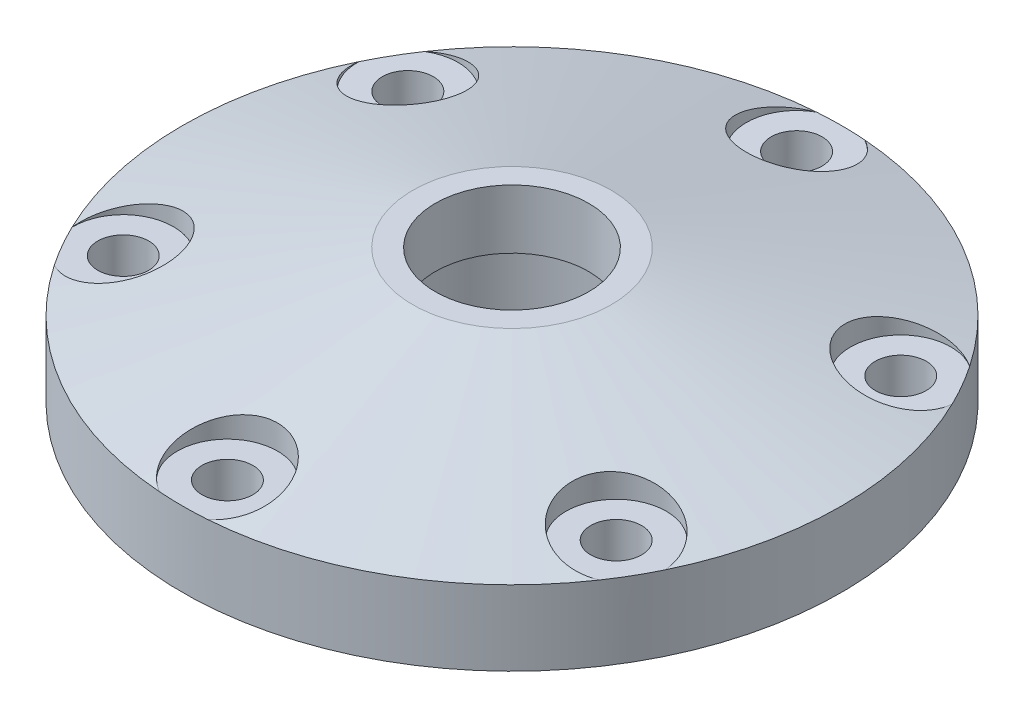
from build123d import *

# Parameters (mm, degrees)
M3_CLEARANCE_HOLE1_AT_2_COUNT  = 2
M3_CLEARANCE_HOLE1_AT_2_PITCH  = 19
M3_CLEARANCE_HOLE1_AT_3_COUNT  = 2
M3_CLEARANCE_HOLE1_AT_3_PITCH  = 32.908965344
M3_CLEARANCE_HOLE1_AT_4_COUNT  = 2
M3_CLEARANCE_HOLE1_AT_4_PITCH  = 38
M3_CLEARANCE_HOLE1_AT_5_COUNT  = 2
M3_CLEARANCE_HOLE1_AT_5_PITCH  = 32.908965344
M3_CLEARANCE_HOLE1_AT_6_COUNT  = 2
M3_CLEARANCE_HOLE1_AT_6_PITCH  = 19
M3_CLEARANCE_HOLE1_AT_7_COUNT  = 2
M3_CLEARANCE_HOLE1_AT_7_PITCH  = 19
CBORE_FOR_M3_SBHCS7_AT_2_COUNT = 2
CBORE_FOR_M3_SBHCS7_AT_2_PITCH = 19
CBORE_FOR_M3_SBHCS7_AT_3_COUNT = 2
CBORE_FOR_M3_SBHCS7_AT_3_PITCH = 32.908965344
CBORE_FOR_M3_SBHCS7_AT_4_COUNT = 2
CBORE_FOR_M3_SBHCS7_AT_4_PITCH = 38
CBORE_FOR_M3_SBHCS7_AT_5_COUNT = 2
CBORE_FOR_M3_SBHCS7_AT_5_PITCH = 32.908965344
CBORE_FOR_M3_SBHCS7_AT_6_COUNT = 2
CBORE_FOR_M3_SBHCS7_AT_6_PITCH = 19


with BuildPart() as part:
    # Sketch1 → Revolve1 (revolve)
    with BuildSketch(Plane.XY):
        Polygon((5.12, 5), (5.12, 8.9453), (6.625, 8.9453), (22, 5), (22, 0), (6.75, 0), (6.75, 5), align=None)
    revolve(axis=Axis((0, 0, 0), (0, 1, 0)))

    # Sketch3 → M3 Clearance Hole1 (revolve, cut)
    with BuildSketch(Plane(origin=(0, 5, -19), x_dir=(0, 0, 1), z_dir=(1, 0, 0))):
        Polygon((0, 0), (0, 6.021463052), (1.7, 5), (1.7, 0), align=None)
    m3_clearance_hole1 = revolve(axis=Axis((0, 11.35, -19), (0, -1, 0)), mode=Mode.SUBTRACT)

    # M3 Clearance Hole1 at 2: M3 Clearance Hole1 ×2
    with Locations(*[Vector(0.8660254037844387, 0, 0.49999999999999994) * (i * M3_CLEARANCE_HOLE1_AT_2_PITCH) for i in range(1, M3_CLEARANCE_HOLE1_AT_2_COUNT)]):
        add(m3_clearance_hole1, mode=Mode.SUBTRACT)

    # M3 Clearance Hole1 at 3: M3 Clearance Hole1 ×2
    with Locations(*[Vector(0.5000000000000001, 0, 0.8660254037844386) * (i * M3_CLEARANCE_HOLE1_AT_3_PITCH) for i in range(1, M3_CLEARANCE_HOLE1_AT_3_COUNT)]):
        add(m3_clearance_hole1, mode=Mode.SUBTRACT)

    # M3 Clearance Hole1 at 4: M3 Clearance Hole1 ×2
    with Locations(*[(0, 0, i * M3_CLEARANCE_HOLE1_AT_4_PITCH) for i in range(1, M3_CLEARANCE_HOLE1_AT_4_COUNT)]):
        add(m3_clearance_hole1, mode=Mode.SUBTRACT)

    # M3 Clearance Hole1 at 5: M3 Clearance Hole1 ×2
    with Locations(*[Vector(-0.49999999999999983, 0, 0.8660254037844388) * (i * M3_CLEARANCE_HOLE1_AT_5_PITCH) for i in range(1, M3_CLEARANCE_HOLE1_AT_5_COUNT)]):
        add(m3_clearance_hole1, mode=Mode.SUBTRACT)

    # M3 Clearance Hole1 at 6: M3 Clearance Hole1 ×2
    with Locations(*[Vector(-0.8660254037844387, 0, 0.4999999999999999) * (i * M3_CLEARANCE_HOLE1_AT_6_PITCH) for i in range(1, M3_CLEARANCE_HOLE1_AT_6_COUNT)]):
        add(m3_clearance_hole1, mode=Mode.SUBTRACT)

    # M3 Clearance Hole1 at 7: M3 Clearance Hole1 ×2
    with Locations(*[(0, 0, i * M3_CLEARANCE_HOLE1_AT_7_PITCH) for i in range(1, M3_CLEARANCE_HOLE1_AT_7_COUNT)]):
        add(m3_clearance_hole1, mode=Mode.SUBTRACT)

    # Sketch5 → CBORE for M3 SBHCS7 (revolve, cut)
    with BuildSketch(Plane(origin=(-16.454482672, 5, -9.5), x_dir=(0, 0, -1), z_dir=(1, 0, 0))):
        Polygon((0, 0), (0, 4.966763052), (1.7, 3.9453), (1.7, 1.65), (3.35, 1.65), (3.35, 0), align=None)
    cbore_for_m3_sbhcs7 = revolve(axis=Axis((-16.454482672, -1.35, -9.5), (0, 1, 0)), mode=Mode.SUBTRACT)

    # CBORE for M3 SBHCS7 at 2: CBORE for M3 SBHCS7 ×2
    with Locations(*[Vector(0.8660254037844387, 0, -0.4999999999999999) * (i * CBORE_FOR_M3_SBHCS7_AT_2_PITCH) for i in range(1, CBORE_FOR_M3_SBHCS7_AT_2_COUNT)]):
        add(cbore_for_m3_sbhcs7, mode=Mode.SUBTRACT)

    # CBORE for M3 SBHCS7 at 3: CBORE for M3 SBHCS7 ×2
    with Locations(*[(i * CBORE_FOR_M3_SBHCS7_AT_3_PITCH, 0, 0) for i in range(1, CBORE_FOR_M3_SBHCS7_AT_3_COUNT)]):
        add(cbore_for_m3_sbhcs7, mode=Mode.SUBTRACT)

    # CBORE for M3 SBHCS7 at 4: CBORE for M3 SBHCS7 ×2
    with Locations(*[Vector(0.8660254037844387, 0, 0.49999999999999994) * (i * CBORE_FOR_M3_SBHCS7_AT_4_PITCH) for i in range(1, CBORE_FOR_M3_SBHCS7_AT_4_COUNT)]):
        add(cbore_for_m3_sbhcs7, mode=Mode.SUBTRACT)

    # CBORE for M3 SBHCS7 at 5: CBORE for M3 SBHCS7 ×2
    with Locations(*[Vector(0.49999999999999994, 0, 0.8660254037844387) * (i * CBORE_FOR_M3_SBHCS7_AT_5_PITCH) for i in range(1, CBORE_FOR_M3_SBHCS7_AT_5_COUNT)]):
        add(cbore_for_m3_sbhcs7, mode=Mode.SUBTRACT)

    # CBORE for M3 SBHCS7 at 6: CBORE for M3 SBHCS7 ×2
    with Locations(*[(0, 0, i * CBORE_FOR_M3_SBHCS7_AT_6_PITCH) for i in range(1, CBORE_FOR_M3_SBHCS7_AT_6_COUNT)]):
        add(cbore_for_m3_sbhcs7, mode=Mode.SUBTRACT)


solid = part.part
